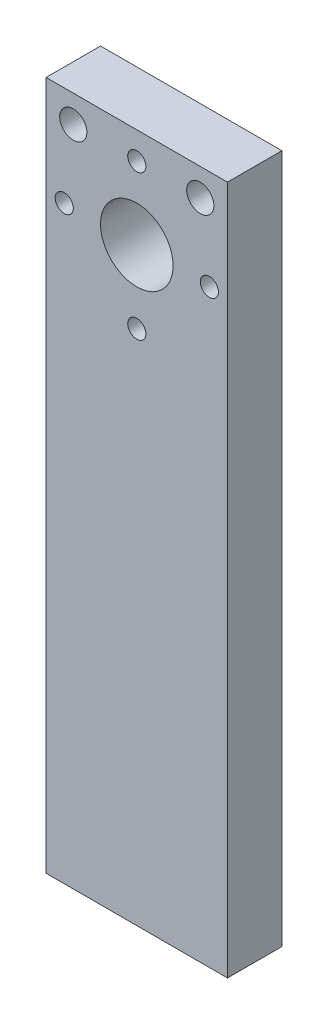
from build123d import *

# Parameters (mm, degrees)
ESQUISSE1_W             = 20
ESQUISSE1_H             = 76
BOSS_EXTRU_1_DEPTH      = 6
ESQUISSE2_R             = 4
ESQUISSE2_R_2           = 1
ESQUISSE2_R_3           = 1.5
ENL_V_MAT_EXTRU_1_DEPTH = 6


with BuildPart() as part:
    # Esquisse1 → Boss.-Extru.1 (new body)
    with BuildSketch(Plane.XY):
        Rectangle(ESQUISSE1_W, ESQUISSE1_H)
    extrude(amount=BOSS_EXTRU_1_DEPTH)

    # Esquisse2 → Enlèv. mat.-Extru.1 (cut)
    with BuildSketch(Plane.XY.offset(6)):
        with Locations((0, 27)):
            Circle(ESQUISSE2_R)
        with Locations((0, 35)):
            Circle(ESQUISSE2_R_2)
        with Locations((-8, 27)):
            Circle(ESQUISSE2_R_2)
        with Locations((0, 19)):
            Circle(ESQUISSE2_R_2)
        with Locations((8, 27)):
            Circle(ESQUISSE2_R_2)
        with Locations((-7, 35)):
            Circle(ESQUISSE2_R_3)
        with Locations((7, 35)):
            Circle(ESQUISSE2_R_3)
    extrude(amount=-ENL_V_MAT_EXTRU_1_DEPTH, mode=Mode.SUBTRACT)


solid = part.part
